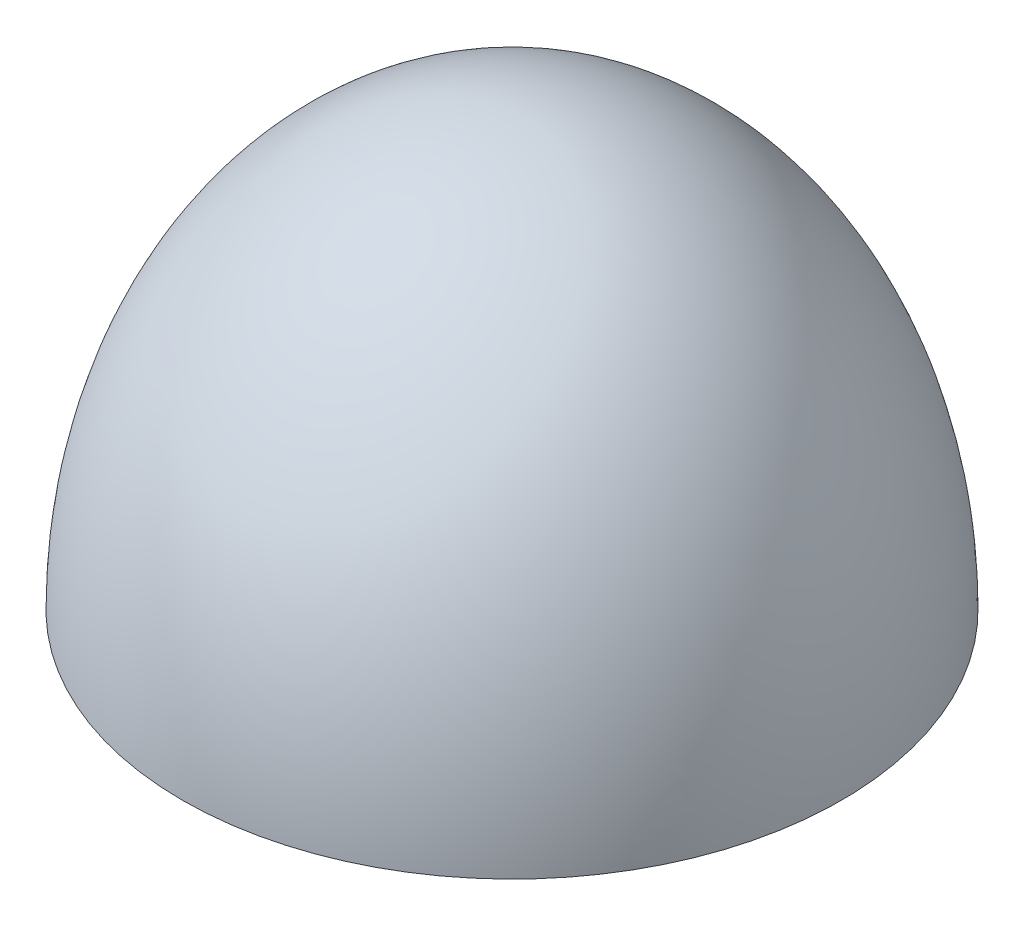
from build123d import *


with BuildPart() as part:
    # Sketch1 → Revolve1 (revolve)
    with BuildSketch(Plane(origin=(0, 0, 0), x_dir=(0, 0, -1), z_dir=(1, 0, 0))):
        with BuildLine():
            Line((-2.5, 0), (-5, 0))
            add(Edge.make_bspline(
                [(0, 6.5), (-5, 6.5), (-5, 0)],
                knots=[0, 0, 0, 1.570796327, 1.570796327, 1.570796327], degree=2, weights=[1, 0.707106781, 1]))
            Line((0, 6.5), (0, 4))
            Line((0, 4), (-2.5, 4))
            Line((-2.5, 4), (-2.5, 0))
        make_face()
    revolve(axis=Axis((0, 4, 0), (0, 1, 0)))


solid = part.part
